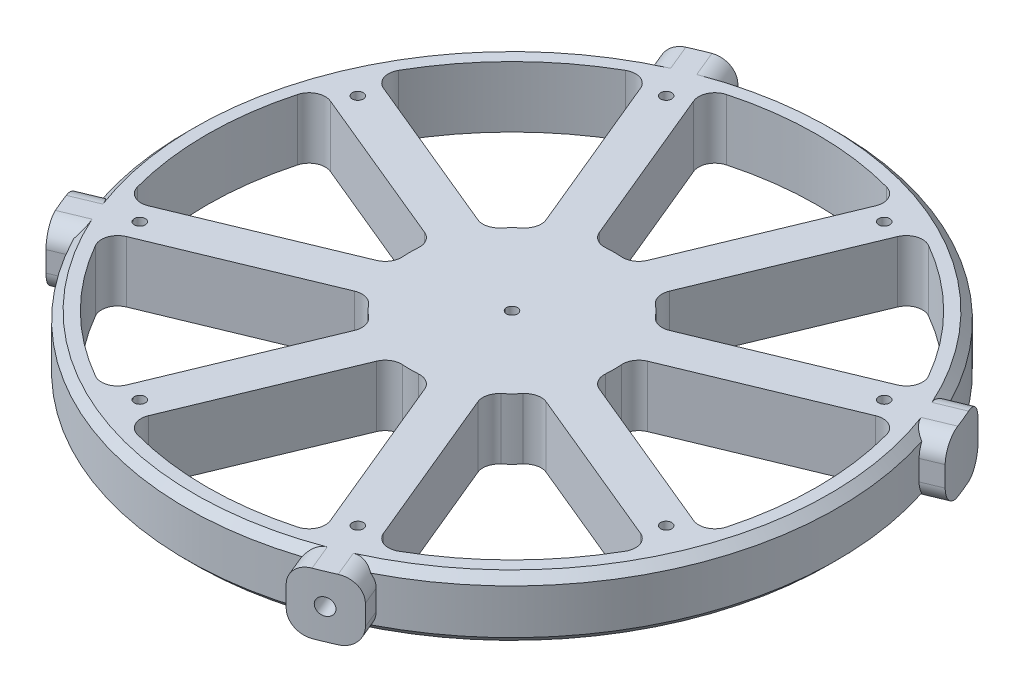
from build123d import *

# Parameters (mm, degrees)
F_6_32_TAPPED_HOLE2_D    = 2.7051
CIRPATTERN3_COUNT        = 8
CUT_EXTRUDE1_DEPTH       = 115.12688377441049
FILLET1_R                = 4
CIRPATTERN4_COUNT        = 8
FILLET1_OF_CIRPATTERN4_R = 4
F_6_32_TAPPED_HOLE1_D    = 2.7051
BOSS_EXTRUDE1_DEPTH      = 15
FILLET2_R                = 5
CIRPATTERN5_COUNT        = 4
FILLET2_OF_CIRPATTERN5_R = 5
CHAMFER1_SIZE            = 2


with BuildPart() as part:
    # Sketch2 → Revolve1 (revolve)
    with BuildSketch(Plane(origin=(0, 0, 0), x_dir=(0, 0, -1), z_dir=(1, 0, 0))):
        Polygon((0, 0), (-79.99983, -9.8e-15), (-79.99983, 14.99999999999999), (0, 14.99999999999999), align=None)
    revolve(axis=Axis((0, -1.0952498586475945, 0), (0, 1, 0)))

    # #6-32 Tapped Hole2 (through all)
    with Locations(Plane(origin=(0, 14.99999999999999, 0), x_dir=(1, 0, 0), z_dir=(0, 1, 0))):
        with Locations((-26.787840266, 64.671567276)):
            f_6_32_tapped_hole2 = Hole(F_6_32_TAPPED_HOLE2_D / 2)

    # CirPattern3: #6-32 Tapped Hole2 ×8 about axis
    cirpattern3_axis = Axis((0, -1.0952498586475945, 0), (0, 1, 0))
    for i in range(1, CIRPATTERN3_COUNT):
        add(f_6_32_tapped_hole2.rotate(cirpattern3_axis, i * 360 / CIRPATTERN3_COUNT), mode=Mode.SUBTRACT)

    # Sketch8 → Cut-Extrude1 (cut, through all)
    with BuildSketch(Plane(origin=(0, 14.99999999999999, 0), x_dir=(1, 0, 0), z_dir=(0, 1, 0))):
        with BuildLine():
            Line((-4.7543937605570585, 24.54375154636259), (-24.017942966303664, 71.05007329831746))
            ThreePointArc((-24.017942966303664, 71.05007329831746), (4.59e-15, 74.99982999999999), (24.017942966303664, 71.05007329831746))
            Line((24.017942966303664, 71.05007329831746), (4.7543937605570585, 24.54375154636259))
            ThreePointArc((4.7543937605570585, 24.54375154636259), (1.53e-15, 24.999999999999996), (-4.7543937605570585, 24.54375154636259))
        make_face()
    cut_extrude1 = extrude(amount=-CUT_EXTRUDE1_DEPTH, mode=Mode.SUBTRACT)

    # Fillet1
    fillet1_edges = [part.edges().sort_by_distance(p)[0] for p in [
        (4.754393760557059, 7.499999999999995, -24.543751546362593),
        (24.01794296630367, 7.499999999999995, -71.05007329831744),
        (-4.754393760557059, 7.499999999999995, -24.543751546362593),
        (-24.017942966303664, 7.499999999999995, -71.05007329831744),
    ]]
    fillet(fillet1_edges, radius=FILLET1_R)

    # CirPattern4: Cut-Extrude1 ×8 about axis
    cirpattern4_axis = Axis((0, -1.0952498586475945, 0), (0, 1, 0))
    for i in range(1, CIRPATTERN4_COUNT):
        add(cut_extrude1.rotate(cirpattern4_axis, i * 360 / CIRPATTERN4_COUNT), mode=Mode.SUBTRACT)

    # Fillet1 of CirPattern4
    fillet1_of_cirpattern4_edges = [part.edges().sort_by_distance(p)[0] for p in [
        (-13.99318908566989, 7.499999999999995, -20.71691722271171),
        (-33.25673829141644, 7.499999999999995, -67.22323897466659),
        (-20.716917222711707, 7.499999999999995, -13.993189085669895),
        (-67.22323897466657, 7.499999999999995, -33.256738291416454),
        (-24.543751546362593, 7.499999999999995, -4.754393760557061),
        (-71.05007329831744, 7.499999999999995, -24.017942966303675),
        (-24.543751546362593, 7.499999999999995, 4.754393760557058),
        (-71.05007329831744, 7.499999999999995, 24.01794296630366),
        (-20.71691722271171, 7.499999999999995, 13.99318908566989),
        (-67.22323897466659, 7.499999999999995, 33.25673829141644),
        (-13.993189085669895, 7.499999999999995, 20.716917222711707),
        (-33.256738291416454, 7.499999999999995, 67.22323897466657),
        (-4.754393760557062, 7.499999999999995, 24.543751546362593),
        (-24.01794296630368, 7.499999999999995, 71.05007329831744),
        (4.754393760557057, 7.499999999999995, 24.543751546362593),
        (24.017942966303657, 7.499999999999995, 71.05007329831744),
        (13.99318908566989, 7.499999999999995, 20.716917222711714),
        (33.25673829141644, 7.499999999999995, 67.2232389746666),
        (20.716917222711707, 7.499999999999995, 13.993189085669899),
        (67.22323897466657, 7.499999999999995, 33.25673829141647),
        (24.543751546362593, 7.499999999999995, 4.754393760557064),
        (71.05007329831744, 7.499999999999995, 24.017942966303686),
        (24.543751546362593, 7.499999999999995, -4.754393760557055),
        (71.05007329831744, 7.499999999999995, -24.01794296630365),
        (20.71691722271171, 7.499999999999995, -13.99318908566989),
        (67.2232389746666, 7.499999999999995, -33.25673829141643),
        (13.993189085669899, 7.499999999999995, -20.716917222711707),
        (33.25673829141647, 7.499999999999995, -67.22323897466657),
    ]]
    fillet(fillet1_of_cirpattern4_edges, radius=FILLET1_OF_CIRPATTERN4_R)

    # #6-32 Tapped Hole1 (through all)
    with Locations(Plane(origin=(0, 0, 0), x_dir=(-1, 0, 0), z_dir=(0, -1, 0))):
        with Locations((0, 0)):
            Hole(F_6_32_TAPPED_HOLE1_D / 2)

    # Sketch12 → Boss-Extrude1 (add)
    with BuildSketch(Plane(origin=(0, 14.99999999999999, 0), x_dir=(1, 0, 0), z_dir=(0, 1, 0))):
        with BuildLine():
            Line((-23.598668372771456, 76.44001341614779), (-25.473817191360403, 80.96702312545311))
            ThreePointArc((-25.473817191360403, 80.96702312545311), (-32.48207910891059, 78.41867591880764), (-39.2396222257786, 75.26503998321326))
            Line((-39.2396222257786, 75.26503998321326), (-37.36447340718965, 70.73803027390794))
            ThreePointArc((-37.36447340718965, 70.73803027390794), (-30.61460953302372, 73.91020554138238), (-23.598668372771456, 76.44001341614779))
        make_face()
    boss_extrude1 = extrude(amount=-BOSS_EXTRUDE1_DEPTH)

    # Fillet2
    fillet2_edges = [part.edges().sort_by_distance(p)[0] for p in [
        (-24.53624278206593, 14.99999999999999, -78.70351827080046),
        (-38.30204781648412, 14.99999999999999, -73.00153512856059),
        (-24.53624278206593, -1.066e-14, -78.70351827080046),
        (-38.30204781648412, -1.066e-14, -73.00153512856059),
    ]]
    fillet(fillet2_edges, radius=FILLET2_R)

    # CirPattern5: Boss-Extrude1 ×4 about axis
    cirpattern5_axis = Axis((0, -1.0952498586475945, 0), (0, 1, 0))
    for i in range(1, CIRPATTERN5_COUNT):
        add(boss_extrude1.rotate(cirpattern5_axis, i * 360 / CIRPATTERN5_COUNT))

    # Fillet2 of CirPattern5
    fillet2_of_cirpattern5_edges = [part.edges().sort_by_distance(p)[0] for p in [
        (-78.70351827080046, 14.99999999999999, 24.536242782065926),
        (-73.00153512856059, 14.99999999999999, 38.30204781648411),
        (-78.70351827080046, -1.066e-14, 24.536242782065926),
        (-73.00153512856059, -1.066e-14, 38.30204781648411),
        (24.53624278206592, 14.99999999999999, 78.70351827080046),
        (38.30204781648411, 14.99999999999999, 73.00153512856059),
        (24.53624278206592, -1.066e-14, 78.70351827080046),
        (38.30204781648411, -1.066e-14, 73.00153512856059),
        (78.70351827080046, 14.99999999999999, -24.536242782065916),
        (73.00153512856059, 14.99999999999999, -38.302047816484105),
        (78.70351827080046, -1.066e-14, -24.536242782065916),
        (73.00153512856059, -1.066e-14, -38.302047816484105),
    ]]
    fillet(fillet2_of_cirpattern5_edges, radius=FILLET2_OF_CIRPATTERN5_R)

    # Chamfer1
    chamfer1_edges = [part.edges().sort_by_distance(p)[0] for p in [
        (73.91020554138242, 9.06e-15, 30.614609533023646),
        (-30.614609533023643, 2.717e-14, 73.91020554138242),
        (-73.91020554138242, 2.717e-14, -30.614609533023643),
        (-73.91020554138242, 14.99999999999999, -30.614609533023643),
        (-30.614609533023643, 14.99999999999999, 73.91020554138242),
        (73.91020554138242, 14.99999999999999, 30.614609533023646),
        (30.614609533023657, 9.06e-15, -73.91020554138244),
        (30.614609533023657, 14.99999999999999, -73.91020554138244),
    ]]
    chamfer(chamfer1_edges, length=CHAMFER1_SIZE)

    # Sketch15 → #20 (0.161) Diameter Hole1 (revolve, cut)
    with BuildSketch(Plane(origin=(0, 7.5, 0), x_dir=(-0.9238795325112864, 0, 0.38268343236509056), z_dir=(0, 1, 0))):
        Polygon((0, 0), (-2.6e-14, 106.1589018618328), (2.044699999999976, 106.1589018618328), (2.0446999999999877, -1.3e-15), align=None)
    revolve(axis=Axis((-2.4300397955183217, 7.5, -5.866635031446661), (0.38268343236509056, 0, 0.9238795325112865)), mode=Mode.SUBTRACT)


solid = part.part
